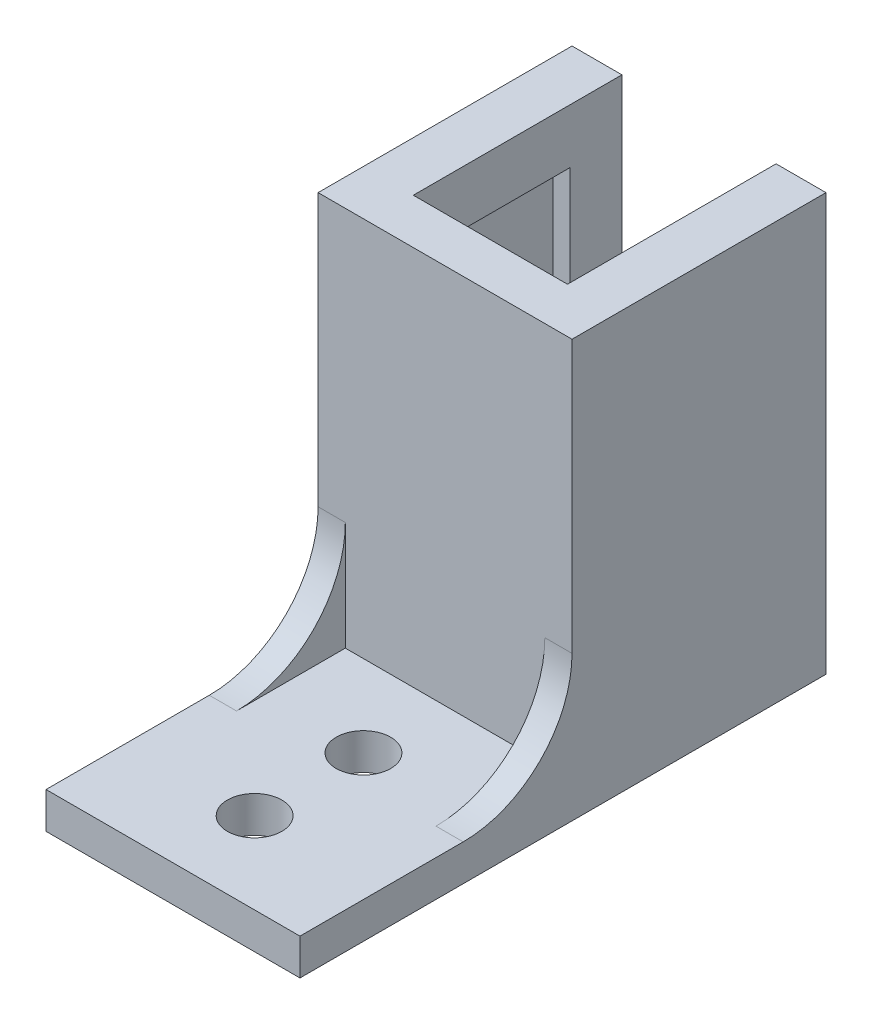
from build123d import *

# Parameters (mm, degrees)
SKETCH1_W           = 14
SKETCH1_H           = 23
BOSS_EXTRUDE1_DEPTH = 14
CUT_EXTRUDE1_DEPTH  = 20
SKETCH3_W           = 14
SKETCH3_H           = 15
SKETCH3_R           = 1.5
BOSS_EXTRUDE2_DEPTH = 2
BOSS_EXTRUDE3_DEPTH = 1.5
SKETCH5_W           = 8.5
SKETCH5_H           = 11.5
CUT_EXTRUDE2_DEPTH  = 36.916569992


with BuildPart() as part:
    # Sketch1 → Boss-Extrude1 (new body)
    with BuildSketch(Plane.XY):
        Rectangle(SKETCH1_W, SKETCH1_H)
    extrude(amount=BOSS_EXTRUDE1_DEPTH)

    # Sketch2 → Cut-Extrude1 (cut)
    with BuildSketch(Plane.XZ.offset(11.5)):
        Polygon((4.25, 2.85), (5.2, 2.85), (5.2, 11.5), (-5.2, 11.5), (-5.2, 2.85), (-4.25, 2.85), (-4.25, 0), (4.25, 0), align=None)
    extrude(amount=-CUT_EXTRUDE1_DEPTH, mode=Mode.SUBTRACT)

    # Sketch3 → Boss-Extrude2 (add)
    with BuildSketch(Plane.XZ.offset(11.5)):
        with Locations((0, 21.5)):
            Rectangle(SKETCH3_W, SKETCH3_H)
        with Locations((0, 18.5)):
            Circle(SKETCH3_R, mode=Mode.SUBTRACT)
        with Locations((0, 24.5)):
            Circle(SKETCH3_R, mode=Mode.SUBTRACT)
    extrude(amount=-BOSS_EXTRUDE2_DEPTH)

    # Sketch4 → Boss-Extrude3 (add)
    with BuildSketch(Plane.ZY.offset(7)):
        with BuildLine():
            Line((14, -3.5), (14, -9.5))
            Line((14, -9.5), (20, -9.5))
            ThreePointArc((20, -9.5), (15.757359313, -7.742640687), (14, -3.5))
        make_face()
    boss_extrude3 = extrude(amount=-BOSS_EXTRUDE3_DEPTH)

    # Mirror1: Boss-Extrude3 across plane
    add(boss_extrude3.mirror(Plane(origin=(0, 0, 0), x_dir=(0, 0, 1), z_dir=(1, 0, 0))))

    # Sketch5 → Cut-Extrude2 (cut, through all)
    with BuildSketch(Plane.XZ.offset(-8.5)):
        with Locations((0, 5.75)):
            Rectangle(SKETCH5_W, SKETCH5_H)
    extrude(amount=-CUT_EXTRUDE2_DEPTH, mode=Mode.SUBTRACT)


solid = part.part
